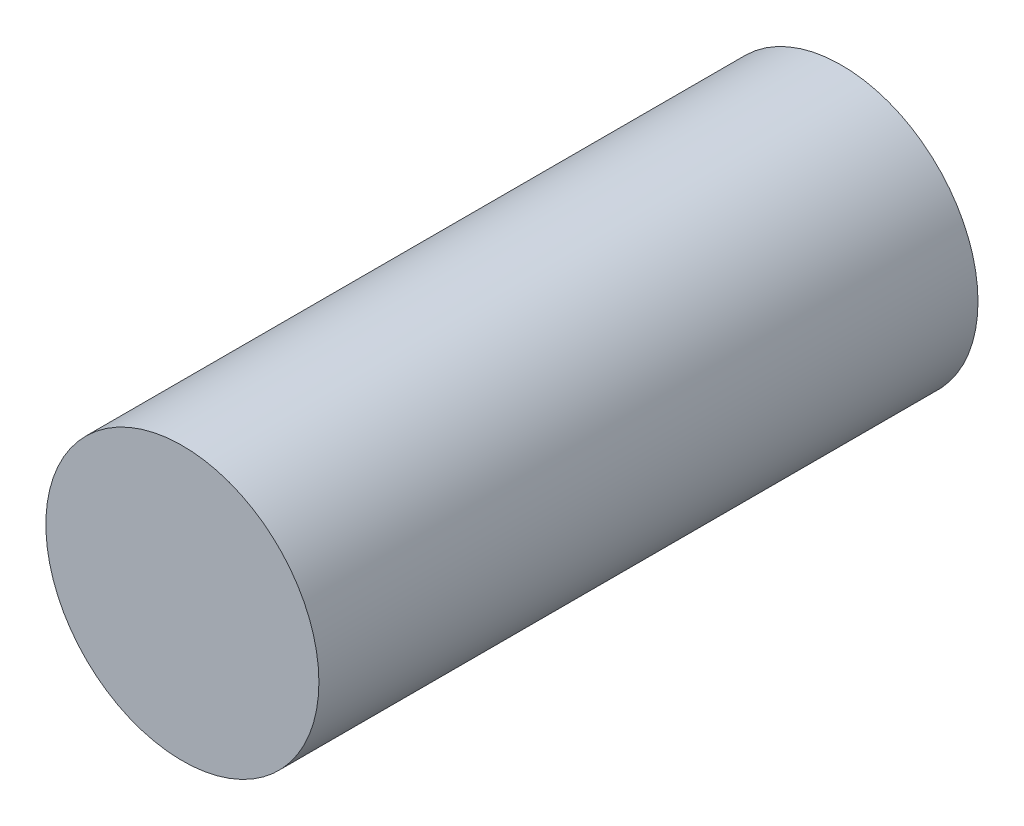
from build123d import *

# Parameters (mm, degrees)
SKETCH1_R           = 36.83
BOSS_EXTRUDE1_DEPTH = 177.8


with BuildPart() as part:
    # Sketch1 → Boss-Extrude1 (new body)
    with BuildSketch(Plane.XY):
        Circle(SKETCH1_R)
    extrude(amount=BOSS_EXTRUDE1_DEPTH)


solid = part.part
